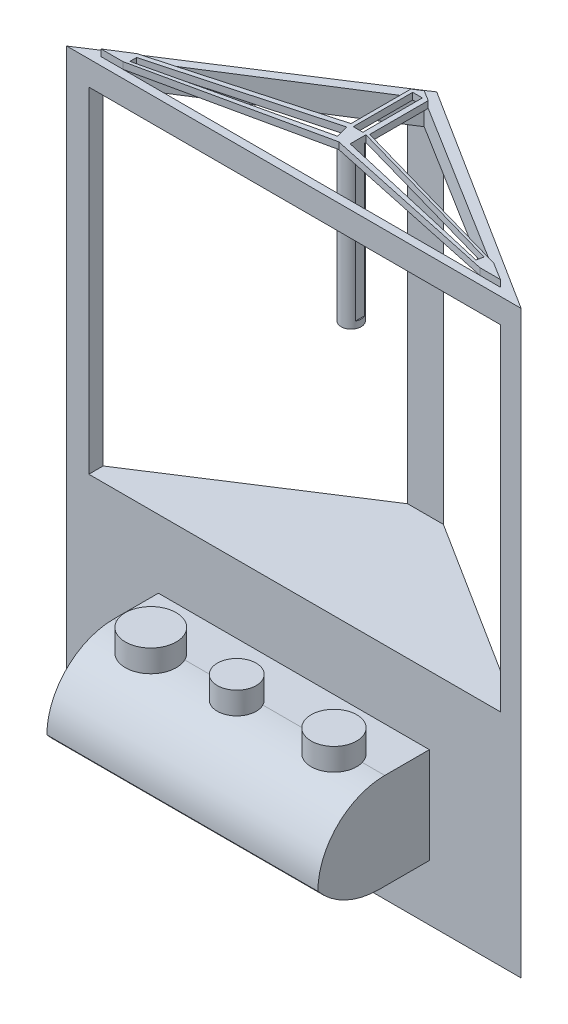
from build123d import *

# Parameters (mm, degrees)
BOSS_EXTRUDE2_DEPTH  = 130
CUT_EXTRUDE2_DEPTH   = 20
SKETCH8_W            = 92.275500819
SKETCH8_H            = 75.162589758
CUT_EXTRUDE3_DEPTH   = 30
SKETCH10_W           = 60.744023663
SKETCH10_H           = 21.51350838
BOSS_EXTRUDE3_DEPTH  = 25
FILLET1_R            = 15
FILLET2_R            = 18
SKETCH13_R           = 5.696863497
BOSS_EXTRUDE4_DEPTH  = 5
SKETCH14_R           = 5.104237625
BOSS_EXTRUDE5_DEPTH  = 5
SKETCH15_R           = 4.356425027
BOSS_EXTRUDE6_DEPTH  = 5
BOSS_EXTRUDE7_DEPTH  = 1.5
BOSS_EXTRUDE8_DEPTH  = 1.5
BOSS_EXTRUDE9_DEPTH  = 1.5
SKETCH19_R           = 2.254219404
BOSS_EXTRUDE10_DEPTH = 35
CUT_EXTRUDE4_DEPTH   = 169.339518256
CUT_EXTRUDE7_DEPTH   = 35
SKETCH23_W           = 2.171886621
SKETCH23_H           = 13.331749198
CUT_EXTRUDE9_DEPTH   = 36


with BuildPart() as part:
    # Sketch1 → Boss-Extrude2 (new body)
    with BuildSketch(Plane(origin=(0, 0, 0), x_dir=(1, 0, 0), z_dir=(0, 1, 0))):
        Polygon((0, 0), (50.395449795, 32.562227195), (101.871952797, 0), align=None)
    extrude(amount=BOSS_EXTRUDE2_DEPTH)

    # Sketch9 → Cut-Extrude2 (cut)
    with BuildSketch(Plane(origin=(0, 130, 0), x_dir=(1, 0, 0), z_dir=(0, 1, 0))):
        Polygon((5.935675774, 1.783636913), (50.266826947, 29.887913883), (95.434414934, 1.783636913), align=None)
    extrude(amount=-CUT_EXTRUDE2_DEPTH, mode=Mode.SUBTRACT)

    # Sketch8 → Cut-Extrude3 (cut)
    with BuildSketch(Plane.XY):
        with Locations((51.103750037, 86.929527723)):
            Rectangle(SKETCH8_W, SKETCH8_H)
    extrude(amount=-CUT_EXTRUDE3_DEPTH, mode=Mode.SUBTRACT)

    # Sketch10 → Boss-Extrude3 (add)
    with BuildSketch(Plane.XY):
        with Locations((50.935976399, 23.292530585)):
            Rectangle(SKETCH10_W, SKETCH10_H)
    extrude(amount=BOSS_EXTRUDE3_DEPTH)

    # Fillet1
    fillet1_edges = [part.edges().sort_by_distance(p)[0] for p in [
        (50.935976399, 34.049284775, 25),
    ]]
    fillet(fillet1_edges, radius=FILLET1_R)

    # Fillet2
    # the kernel refuses this fillet: 18 mm, written as the material it takes off along each edge
    with BuildSketch(Plane(origin=(115.954462644, 12.535776395, 25), x_dir=(0, 1, 0), z_dir=(-1, 0, 0))) as fillet2_piece_1:
        with BuildLine():
            CenterArc((18, 13.858589765), FILLET2_R, 180, 50.346853939)
            Line((0, 13.858589765), (-0.36, 13.858589765))
            Line((-0.36, 13.858589765), (-0.36, 0))
            Line((-0.36, 0), (0, -0.36))
            ThreePointArc((0, -0.36), (3.25675419, -0.36), (6.283778548, -0.277171795))
            Line((6.283778548, -0.277171795), (6.513508381, 0))
        make_face()
    extrude(amount=130.03697249, mode=Mode.SUBTRACT)

    # Sketch13 → Boss-Extrude4 (add)
    with BuildSketch(Plane(origin=(0, 34.049284775, 0), x_dir=(1, 0, 0), z_dir=(0, 1, 0))):
        with Locations(Location((31.332063776, -12.47170285, 0), (0, 0, 154.286535708))):
            Circle(SKETCH13_R)
    extrude(amount=BOSS_EXTRUDE4_DEPTH)

    # Sketch14 → Boss-Extrude5 (add)
    with BuildSketch(Plane(origin=(0, 34.049284775, 0), x_dir=(1, 0, 0), z_dir=(0, 1, 0))):
        with Locations(Location((71.377663065, -11.466373998, 0), (0, 0, 163.30448122))):
            Circle(SKETCH14_R)
    extrude(amount=BOSS_EXTRUDE5_DEPTH)

    # Sketch15 → Boss-Extrude6 (add)
    with BuildSketch(Plane(origin=(0, 34.049284775, 0), x_dir=(1, 0, 0), z_dir=(0, 1, 0))):
        with Locations(Location((50.098202355, -11.969038424, 0), (0, 0, 153.128894057))):
            Circle(SKETCH15_R)
    extrude(amount=BOSS_EXTRUDE6_DEPTH)


with BuildPart() as body_2:
    # Sketch16 → Boss-Extrude7 (new body)
    with BuildSketch(Plane(origin=(0, 130, 0), x_dir=(1, 0, 0), z_dir=(0, 1, 0))):
        Polygon((10.848743574, 4.898336499), (50.56151381, 15.891818457), (50.609643394, 10.395077478), (10.848743574, 1.783636913), (5.935675774, 1.783636913), align=None)
    extrude(amount=BOSS_EXTRUDE7_DEPTH)

    # Sketch17 → Boss-Extrude8 (add)
    with BuildSketch(Plane(origin=(0, 130, 0), x_dir=(1, 0, 0), z_dir=(0, 1, 0))):
        Polygon((91.550521692, 4.200281597), (50.56151381, 15.891818457), (50.609643394, 10.395077478), (90.861207853, 1.783636913), (95.434414934, 1.783636913), align=None)
    extrude(amount=BOSS_EXTRUDE8_DEPTH)

    # Sketch18 → Boss-Extrude9 (add)
    with BuildSketch(Plane(origin=(0, 130, 0), x_dir=(1, 0, 0), z_dir=(0, 1, 0))):
        Polygon((48.435317206, 28.726805821), (48.435317206, 15.303234385), (50.56151381, 15.891818457), (52.625013027, 15.303234385), (52.625013027, 28.4205981), (50.266826947, 29.887913883), align=None)
    extrude(amount=BOSS_EXTRUDE9_DEPTH)

    # Sketch19 → Boss-Extrude10 (add)
    with BuildSketch(Plane.XZ.offset(-130)):
        with Locations(Location((50.265757164, -13.499292504, 0), (0, 0, 270))):
            Circle(SKETCH19_R)
    extrude(amount=BOSS_EXTRUDE10_DEPTH)

    # Sketch20 → Cut-Extrude4 (cut, through all)
    with BuildSketch(Plane(origin=(0, 130, 0), x_dir=(-1, 0, 0), z_dir=(0, -1, 0))):
        Polygon((-11.566591565, 4.110130279), (-48.623978622, 14.163321071), (-49.387681074, 11.348213118), (-11.566591565, 2.598984994), align=None)
    extrude(amount=-CUT_EXTRUDE4_DEPTH, mode=Mode.SUBTRACT)

    # Sketch21 → Cut-Extrude7 (cut)
    with BuildSketch(Plane(origin=(0, 131.5, 0), x_dir=(1, 0, 0), z_dir=(0, 1, 0))):
        Polygon((52.265848542, 14.814079801), (52.265848542, 11.285215779), (88.911057341, 2.833584376), (89.255107257, 4.325341463), align=None)
    extrude(amount=-CUT_EXTRUDE7_DEPTH, mode=Mode.SUBTRACT)

    # Sketch23 → Cut-Extrude9 (cut)
    with BuildSketch(Plane(origin=(0, 131.5, 0), x_dir=(1, 0, 0), z_dir=(0, 1, 0))):
        with Locations((50.359976677, 21.626478171)):
            Rectangle(SKETCH23_W, SKETCH23_H)
    extrude(amount=-CUT_EXTRUDE9_DEPTH, mode=Mode.SUBTRACT)


solid = Compound([part.part, body_2.part])
